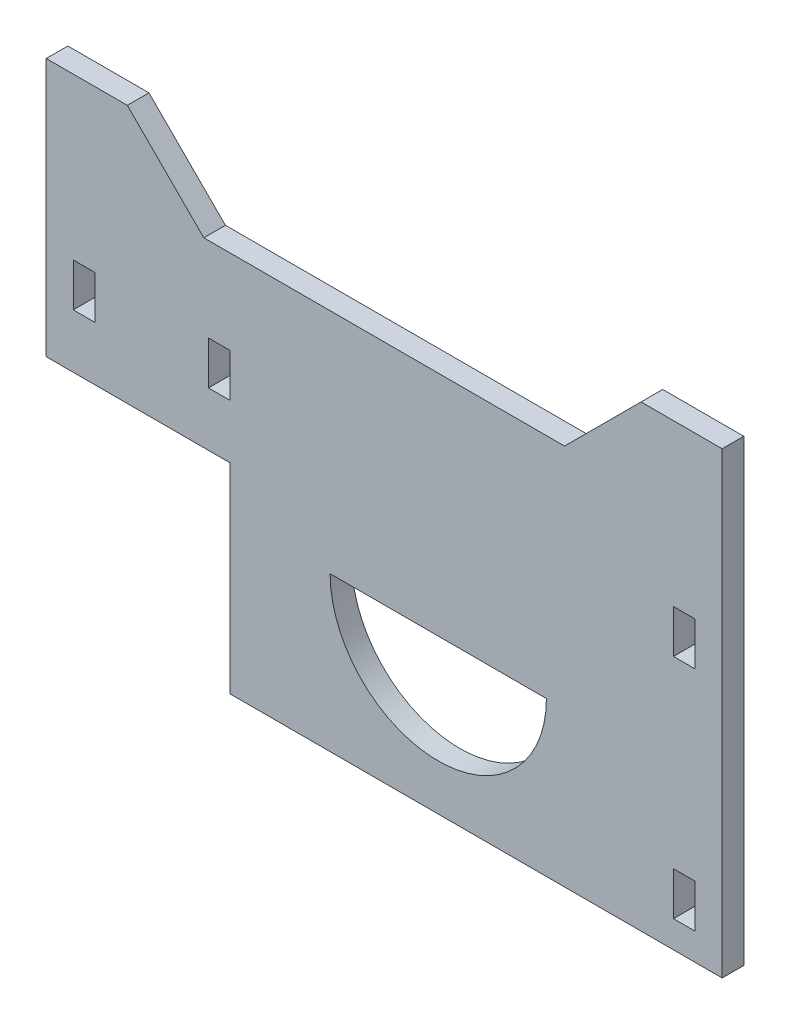
from build123d import *

# Parameters (mm, degrees)
SKETCH1_W           = 4
SKETCH1_H           = 8
BOSS_EXTRUDE1_DEPTH = 4
BOSS_EXTRUDE2_DEPTH = 4


with BuildPart() as part:
    # Sketch1 → Boss-Extrude1 (new body)
    with BuildSketch(Plane.XY):
        Polygon((-72.5, 30), (-72.5, 7), (-38.5, 7), (-38.5, -30), (52.5, -30), (52.5, 30), align=None)
        with BuildLine():
            Line((-20, -1.498357325), (20, -1.498357325))
            ThreePointArc((20, -1.498357325), (0, -21.498357325), (-20, -1.498357325))
        make_face(mode=Mode.SUBTRACT)
        with Locations((-40.5, 21)):
            Rectangle(SKETCH1_W, SKETCH1_H, mode=Mode.SUBTRACT)
        with Locations((45.5, 21)):
            Rectangle(SKETCH1_W, SKETCH1_H, mode=Mode.SUBTRACT)
        with Locations((45.5, -21)):
            Rectangle(SKETCH1_W, SKETCH1_H, mode=Mode.SUBTRACT)
        with Locations((-65.5, 21)):
            Rectangle(SKETCH1_W, SKETCH1_H, mode=Mode.SUBTRACT)
    extrude(amount=BOSS_EXTRUDE1_DEPTH)

    # Sketch2 → Boss-Extrude2 (add)
    with BuildSketch(Plane.XY):
        Polygon((-72.5, 30), (52.5, 30), (52.5, 54.761216718), (37.5, 54.761216718), (23.357864376, 40.619081095), (-43.357864376, 40.619081095), (-57.5, 54.761216718), (-72.5, 54.761216718), align=None)
    extrude(amount=BOSS_EXTRUDE2_DEPTH)


solid = part.part
